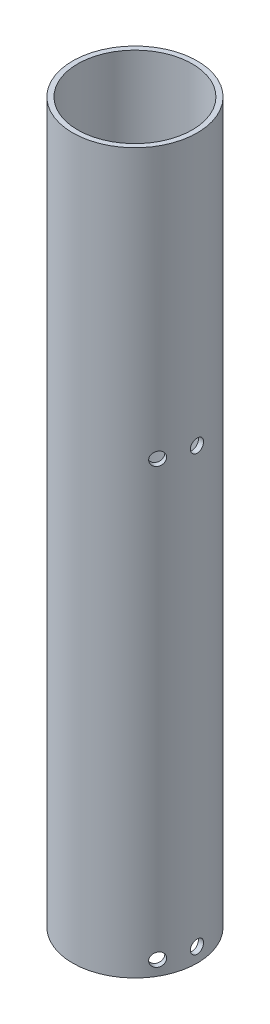
from build123d import *

# Parameters (mm, degrees)
SKETCH1_R               = 26
SKETCH1_R_2             = 23.9
BOSS_EXTRUDE1_DEPTH     = 300
SKETCH3_R               = 2.75
CUT_EXTRUDE2_DEPTH      = 303.244933787
CIRPATTERN1_COUNT       = 3
CUT_EXTRUDE3_DEPTH      = 303.244933904
CUT_EXTRUDE3_DEPTH_BACK = 303.244933904
SKETCH5_R               = 2.75


with BuildPart() as part:
    # Sketch1 → Boss-Extrude1 (new body)
    with BuildSketch(Plane(origin=(0, 0, 0), x_dir=(1, 0, 0), z_dir=(0, 1, 0))):
        Circle(SKETCH1_R)
        Circle(SKETCH1_R_2, mode=Mode.SUBTRACT)
    extrude(amount=BOSS_EXTRUDE1_DEPTH)

    # Sketch3 → Cut-Extrude2 (cut, through all)
    with BuildSketch(Plane.XY):
        with Locations((0, 6)):
            Circle(SKETCH3_R)
        with Locations((0, 187)):
            Circle(SKETCH3_R)
    cut_extrude2 = extrude(amount=-CUT_EXTRUDE2_DEPTH, mode=Mode.SUBTRACT)

    # CirPattern1: Cut-Extrude2 ×3 about axis
    cirpattern1_axis = Axis((0, 300, 0), (0, -1, 0))
    for i in range(1, CIRPATTERN1_COUNT):
        add(cut_extrude2.rotate(cirpattern1_axis, i * 360 / CIRPATTERN1_COUNT), mode=Mode.SUBTRACT)

    # Sketch5 → Cut-Extrude3 (cut, two sides: drawn at the far end of the back side and taken through both)
    with BuildSketch(Plane(origin=(0, 0, 0), x_dir=(0, 0, -1), z_dir=(1, 0, 0)).offset(-CUT_EXTRUDE3_DEPTH_BACK)):
        with Locations((0, 6)):
            Circle(SKETCH5_R)
        with Locations((0, 187)):
            Circle(SKETCH5_R)
    extrude(amount=CUT_EXTRUDE3_DEPTH + CUT_EXTRUDE3_DEPTH_BACK, mode=Mode.SUBTRACT)


solid = part.part
